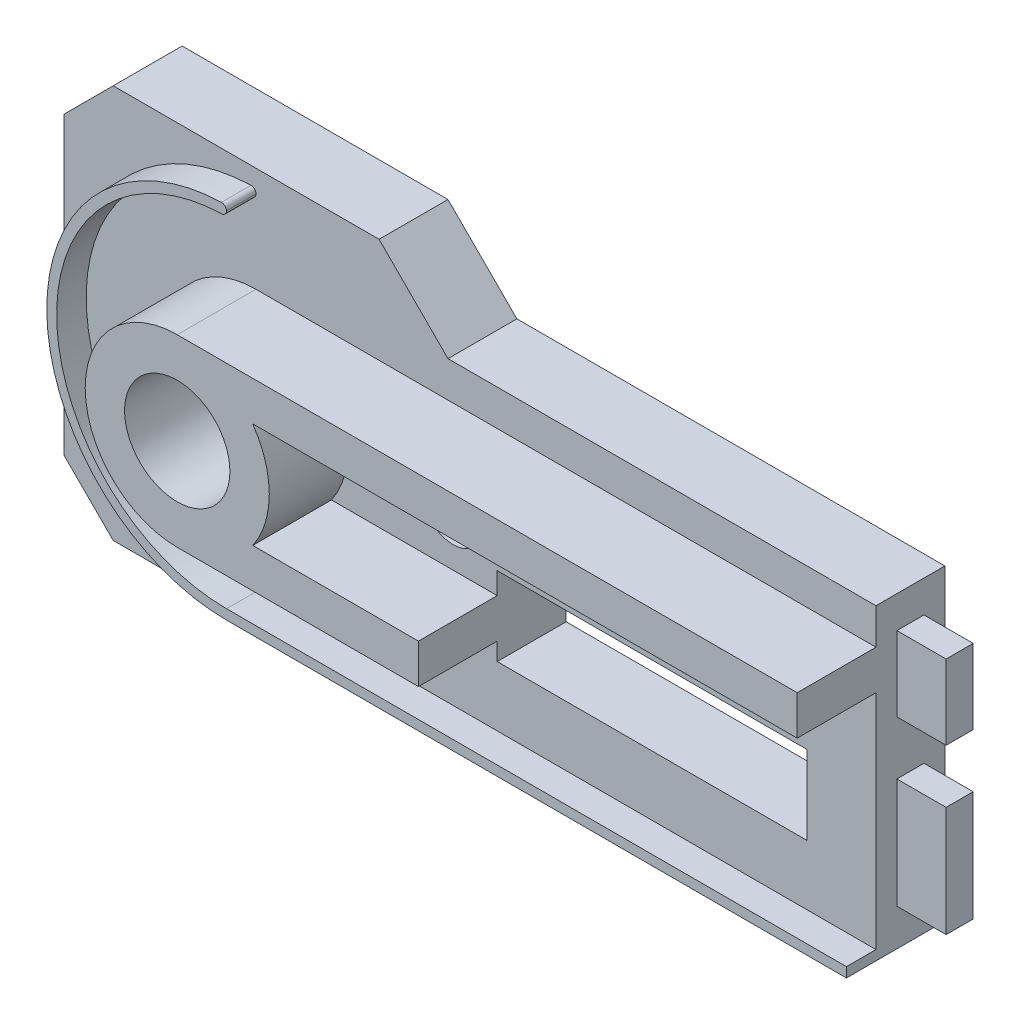
from build123d import *

# Parameters (mm, degrees)
SKETCH1_R               = 5.35
BOSS_EXTRUDE2_DEPTH     = 7
BOSS_EXTRUDE3_START     = 8
SKETCH3_R               = 5.35
BOSS_EXTRUDE3_DEPTH     = 8
BOSS_EXTRUDE4_DEPTH     = 3
CHAMFER1_SIZE           = 10
CHAMFER2_SIZE           = 5
CUT_EXTRUDE1_DEPTH      = 67.560662475
CUT_EXTRUDE1_DEPTH_BACK = 67.560662475
SKETCH5_W               = 31.474956737
SKETCH5_H               = 3.5
SKETCH5_H_2             = 8
CHAMFER3_SIZE           = 7
SKETCH6_W               = 2.75
SKETCH6_H               = 7.59
SKETCH6_H_2             = 11.2
BOSS_EXTRUDE5_DEPTH     = 5
SKETCH7_R               = 11
BOSS_EXTRUDE6_DEPTH     = 5
CUT_EXTRUDE2_REACH      = 87.717
SKETCH8_W               = 8
SKETCH8_H               = 4
SKETCH9_R               = 3.1
CUT_EXTRUDE3_DEPTH      = 4
CUT_EXTRUDE4_START      = -1
SKETCH10_R              = 3.1
CUT_EXTRUDE4_DEPTH      = 1
CHAMFER4_SIZE           = 1
FILLET3_R               = 0.5


# Some blends are built 0.0001 mm under size
with BuildPart() as part:
    # Sketch1 → Boss-Extrude2 (new body)
    with BuildSketch(Plane.XY):
        Polygon((-19.503784034, -20), (19.503784034, -20), (19.503784034, -18.25), (62.978740771, -18.25), (62.978740771, 13), (19.503784034, 13), (19.503784034, 20), (-19.503784034, 20), align=None)
        Circle(SKETCH1_R, mode=Mode.SUBTRACT)
    extrude(amount=-BOSS_EXTRUDE2_DEPTH)

    # Sketch3 → Boss-Extrude3 (add)
    with BuildSketch(Plane.XY.offset(BOSS_EXTRUDE3_START)):
        with BuildLine():
            Line((7.668115805, 5.35), (62.978740771, 5.35))
            Line((62.978740771, 5.35), (62.978740771, 9.35))
            Line((62.978740771, 9.35), (0, 9.35))
            ThreePointArc((0, 9.35), (-9.35, 0), (0, -9.35))
            Line((0, -9.35), (62.978740771, -9.35))
            Line((62.978740771, -9.35), (62.978740771, -5.35))
            Line((62.978740771, -5.35), (7.668115805, -5.35))
            ThreePointArc((7.668115805, -5.35), (9.35, 0), (7.668115805, 5.35))
        make_face()
        Circle(SKETCH3_R, mode=Mode.SUBTRACT)
    extrude(amount=-BOSS_EXTRUDE3_DEPTH)

    # Sketch4 → Boss-Extrude4 (add)
    with BuildSketch(Plane.XY):
        with BuildLine():
            Line((0, -18.25), (62.978740771, -18.25))
            Line((62.978740771, -18.25), (62.978740771, -17.25))
            Line((62.978740771, -17.25), (8.306623863, -17.25))
            Line((8.306623863, -17.25), (0, -17.25))
            ThreePointArc((0, -17.25), (-17.25, 0), (0, 17.25))
            Line((0, 17.25), (0, 18.25))
            ThreePointArc((0, 18.25), (-18.25, 0), (0, -18.25))
        make_face()
    extrude(amount=BOSS_EXTRUDE4_DEPTH)

    # Chamfer1
    # the kernel refuses this chamfer: 10 mm, written as the material it takes off along each edge
    with BuildSketch(Plane(origin=(19.503784034, -20, 25.71682988), x_dir=(-0.9996219169112968, -0.027495876610586317, 0), z_dir=(0, 0, -1))) as chamfer1_piece_1_section:
        Polygon((CHAMFER1_SIZE * 0.999621916911, CHAMFER1_SIZE * 0.0274958766106), (-CHAMFER1_SIZE * 0.0274958766106, CHAMFER1_SIZE * 0.999621916911), (0, 0), align=None)
    chamfer1_piece_1 = extrude(amount=58.433659759, mode=Mode.PRIVATE)
    chamfer1_piece_1 = split(chamfer1_piece_1, bisect_by=Plane(origin=(14.814200223, -18.25, -3.5), z_dir=(0, -1, 0)), keep=Keep.TOP, mode=Mode.PRIVATE)
    add(chamfer1_piece_1, mode=Mode.SUBTRACT)

    # Chamfer2
    chamfer2_edges = [part.edges().sort_by_distance(p)[0] for p in [
        (-19.503784034, -20, -3.5),
        (-19.503784034, 20, -3.5),
    ]]
    chamfer(chamfer2_edges, length=CHAMFER2_SIZE)

    # Sketch5 → Cut-Extrude1 (cut, two sides: drawn at the far end of the back side and taken through both)
    with BuildSketch(Plane.XY.offset(-CUT_EXTRUDE1_DEPTH_BACK)):
        with Locations((40.241262403, 3.6)):
            Rectangle(SKETCH5_W, SKETCH5_H)
        with Locations((40.241262403, -7.15)):
            Rectangle(SKETCH5_W, SKETCH5_H_2)
    extrude(amount=CUT_EXTRUDE1_DEPTH + CUT_EXTRUDE1_DEPTH_BACK, mode=Mode.SUBTRACT)

    # Chamfer3
    chamfer3_edges = [part.edges().sort_by_distance(p)[0] for p in [
        (19.503784034, 20, -3.5),
    ]]
    chamfer(chamfer3_edges, length=CHAMFER3_SIZE - 0.0001)  # a hair under: the kernel refuses the full size

    # Sketch6 → Boss-Extrude5 (add)
    with BuildSketch(Plane(origin=(62.978740771, 0, 0), x_dir=(0, 0, -1), z_dir=(1, 0, 0))):
        with Locations((3.5, 5.955)):
            Rectangle(SKETCH6_W, SKETCH6_H)
        with Locations((3.5, -8.9)):
            Rectangle(SKETCH6_W, SKETCH6_H_2)
    extrude(amount=BOSS_EXTRUDE5_DEPTH)

    # Sketch7 → Boss-Extrude6 (add)
    with BuildSketch(Plane(origin=(0, 0, -7), x_dir=(-1, 0, 0), z_dir=(0, 0, -1))):
        Circle(SKETCH7_R)
    extrude(amount=BOSS_EXTRUDE6_DEPTH)

    # Sketch8 → Cut-Extrude2 (cut, up to next)
    with BuildSketch(Plane(origin=(62.978740771, 0, 0), x_dir=(0, 0, -1), z_dir=(1, 0, 0)), mode=Mode.PRIVATE) as cut_extrude2_sk1:
        with Locations((-4, -7.35)):
            Rectangle(SKETCH8_W, SKETCH8_H)
    cut_extrude2_tool1 = extrude(cut_extrude2_sk1.sketch, amount=-CUT_EXTRUDE2_REACH, mode=Mode.PRIVATE) & part.part
    add(cut_extrude2_tool1.solids().sort_by_distance((62.978741, -7.35, 4))[0], mode=Mode.SUBTRACT)

    # Sketch9 → Cut-Extrude3 (cut)
    with BuildSketch(Plane.XY):
        with Locations((20.003784034, 0)):
            Circle(SKETCH9_R)
    extrude(amount=-CUT_EXTRUDE3_DEPTH, mode=Mode.SUBTRACT)

    # Sketch10 → Cut-Extrude4 (cut)
    with BuildSketch(Plane(origin=(0, 0, -7), x_dir=(-1, 0, 0), z_dir=(0, 0, -1)).offset(CUT_EXTRUDE4_START)):
        with Locations(Location((-20.003784034, 0, 0), (0, 0, 180))):
            Circle(SKETCH10_R)
    extrude(amount=CUT_EXTRUDE4_DEPTH, mode=Mode.SUBTRACT)

    # Chamfer4
    chamfer4_edges = [part.edges().sort_by_distance(p)[0] for p in [
        (16.903784034, 0, -6),
    ]]
    chamfer(chamfer4_edges, length=CHAMFER4_SIZE - 0.0001)  # a hair under: the kernel refuses the full size

    # Fillet3
    fillet3_edges = [part.edges().sort_by_distance(p)[0] for p in [
        (0, 18.25, 1.5),
        (0, 17.25, 1.5),
    ]]
    fillet(fillet3_edges, radius=FILLET3_R - 0.0001)  # a hair under: the kernel refuses the full size


solid = part.part
